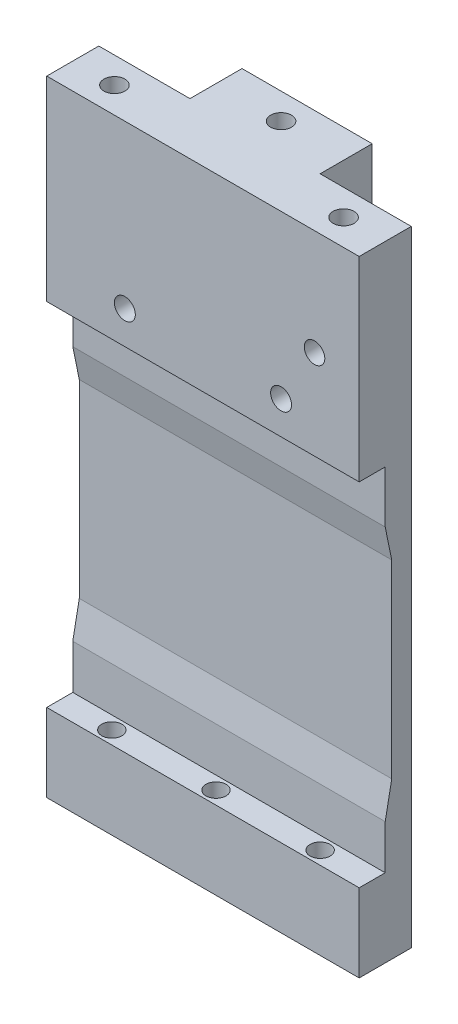
from build123d import *

# Parameters (mm, degrees)
BOSS_EXTRUDE1_DEPTH              = 76.2
CUT_EXTRUDE3_DEPTH               = 47.625
CUT_EXTRUDE4_DEPTH               = 110.433918417
F_10_0_1935_DIAMETER_HOLE1_D     = 4.9149
F_10_0_1935_DIAMETER_HOLE1_DEPTH = 19.05
F_10_0_1935_DIAMETER_HOLE1_TIP   = 1.476584928
F_1_4_20_TAPPED_HOLE1_D          = 5.1054
SKETCH19_R                       = 2.499999953
CUT_EXTRUDE5_DEPTH               = 87.135590889
F_1_4_20_TAPPED_HOLE2_D          = 5.1054
F_1_4_20_TAPPED_HOLE2_DEPTH      = 20.691183098
F_1_4_20_TAPPED_HOLE2_TIP        = 1.533816902
F_1_4_20_TAPPED_HOLE3_D          = 5.1054
F_1_4_20_TAPPED_HOLE3_DEPTH      = 9.05002
F_1_4_20_TAPPED_HOLE3_TIP        = 1.533816902
F_1_4_20_TAPPED_HOLE4_D          = 5.1054
F_1_4_20_TAPPED_HOLE4_DEPTH      = 7.356183098
F_1_4_20_TAPPED_HOLE4_TIP        = 1.533816902


with BuildPart() as part:
    # Sketch1 → Boss-Extrude1 (new, symmetric)
    with BuildSketch(Plane(origin=(0, 0, 0), x_dir=(1, 0, 0), z_dir=(0, 1, 0))):
        Polygon((-15.875, 6.35), (-15.875, 19.05), (15.875, 19.05), (15.875, 6.35), (38.1, 6.35), (38.1, -6.35), (-38.1, -6.35), (-38.1, 6.35), align=None)
    extrude(amount=BOSS_EXTRUDE1_DEPTH, both=True)

    # Sketch5 → Cut-Extrude3 (cut, symmetric)
    with BuildSketch(Plane(origin=(0, 0, 0), x_dir=(1, 0, 0), z_dir=(0, 1, 0))):
        with BuildLine():
            Line((-4.7625, 19.05), (-4.7625, 12.7))
            ThreePointArc((-4.7625, 12.7), (0, 7.9375), (4.7625, 12.7))
            Line((4.7625, 12.7), (4.7625, 19.05))
            Line((4.7625, 19.05), (-4.7625, 19.05))
        make_face()
    extrude(amount=CUT_EXTRUDE3_DEPTH, both=True, mode=Mode.SUBTRACT)

    # Sketch9 → Cut-Revolve1 (revolve, cut)
    with BuildSketch(Plane(origin=(0, 0, 0), x_dir=(0, 0, -1), z_dir=(1, 0, 0))):
        with BuildLine():
            Line((19.05, -52.3875), (12.7, -52.3875))
            ThreePointArc((12.7, -52.3875), (9.332403955, -50.992596045), (7.9375, -47.625))
            Line((7.9375, -47.625), (19.05, -47.625))
            Line((19.05, -47.625), (19.05, -52.3875))
        make_face()
    cut_revolve1 = revolve(axis=Axis((0, -47.625, -7.9375), (0, 0, -1)), mode=Mode.SUBTRACT)

    # Mirror1: Cut-Revolve1 across plane
    add(cut_revolve1.mirror(Plane.ZX), mode=Mode.SUBTRACT)

    # Sketch12 → Cut-Extrude4 (cut, through all)
    with BuildSketch(Plane(origin=(38.1, 0, 0), x_dir=(0, 0, -1), z_dir=(1, 0, 0))):
        Polygon((-6.35, -57.15), (0, -57.15), (0, -46.343697859), (1.5875, -38.1), (1.5875, 8.129025313), (0, 15.875), (0, 28.575), (-6.35, 28.575), align=None)
    extrude(amount=-CUT_EXTRUDE4_DEPTH, mode=Mode.SUBTRACT)

    # #10 (0.1935) Diameter Hole1
    with Locations(Plane(origin=(0, -76.2, 0), x_dir=(-1, 0, 0), z_dir=(0, -1, 0))):
        with Locations((25.4, -3.175), (-25.4, -3.175), (0, -3.175)):
            Hole(F_10_0_1935_DIAMETER_HOLE1_D / 2, depth=F_10_0_1935_DIAMETER_HOLE1_DEPTH)
            with Locations((0, 0, -(F_10_0_1935_DIAMETER_HOLE1_DEPTH + F_10_0_1935_DIAMETER_HOLE1_TIP / 2))):  # 118° drill point
                Cone(0, F_10_0_1935_DIAMETER_HOLE1_D / 2, F_10_0_1935_DIAMETER_HOLE1_TIP, mode=Mode.SUBTRACT)

    # 1/4-20 Tapped Hole1 (through all)
    with Locations(Plane(origin=(0, 76.2, 0), x_dir=(1, 0, 0), z_dir=(0, 1, 0))):
        with Locations((0, 12.7)):
            Hole(F_1_4_20_TAPPED_HOLE1_D / 2)

    # Sketch19 → Cut-Extrude5 (cut, through all)
    with BuildSketch(Plane(origin=(0, 0, -6.35), x_dir=(-1, 0, 0), z_dir=(0, 0, -1))):
        with Locations((-27.209019229, 50.43691079)):
            Circle(SKETCH19_R)
    extrude(amount=-CUT_EXTRUDE5_DEPTH, mode=Mode.SUBTRACT)

    # 1/4-20 Tapped Hole2
    with Locations(Plane(origin=(0, 76.2, 0), x_dir=(1, 0, 0), z_dir=(0, 1, 0))):
        with Locations((27.94, 0), (-27.94, 0)):
            Hole(F_1_4_20_TAPPED_HOLE2_D / 2, depth=F_1_4_20_TAPPED_HOLE2_DEPTH)
            with Locations((0, 0, -(F_1_4_20_TAPPED_HOLE2_DEPTH + F_1_4_20_TAPPED_HOLE2_TIP / 2))):  # 118° drill point
                Cone(0, F_1_4_20_TAPPED_HOLE2_D / 2, F_1_4_20_TAPPED_HOLE2_TIP, mode=Mode.SUBTRACT)

    # 1/4-20 Tapped Hole3
    with Locations(Plane(origin=(0, 0, -19.05), x_dir=(-1, 0, 0), z_dir=(0, 0, -1))):
        with Locations((-9.525, -66.675), (9.525, 57.15), (-9.525, 57.15), (9.525, -66.675)):
            Hole(F_1_4_20_TAPPED_HOLE3_D / 2, depth=F_1_4_20_TAPPED_HOLE3_DEPTH)
            with Locations((0, 0, -(F_1_4_20_TAPPED_HOLE3_DEPTH + F_1_4_20_TAPPED_HOLE3_TIP / 2))):  # 118° drill point
                Cone(0, F_1_4_20_TAPPED_HOLE3_D / 2, F_1_4_20_TAPPED_HOLE3_TIP, mode=Mode.SUBTRACT)

    # 1/4-20 Tapped Hole4
    with Locations(Plane.XY.offset(6.35)):
        with Locations((19.05, 36.610695081), (-19.05, 36.610695081)):
            Hole(F_1_4_20_TAPPED_HOLE4_D / 2, depth=F_1_4_20_TAPPED_HOLE4_DEPTH)
            with Locations((0, 0, -(F_1_4_20_TAPPED_HOLE4_DEPTH + F_1_4_20_TAPPED_HOLE4_TIP / 2))):  # 118° drill point
                Cone(0, F_1_4_20_TAPPED_HOLE4_D / 2, F_1_4_20_TAPPED_HOLE4_TIP, mode=Mode.SUBTRACT)


solid = part.part
